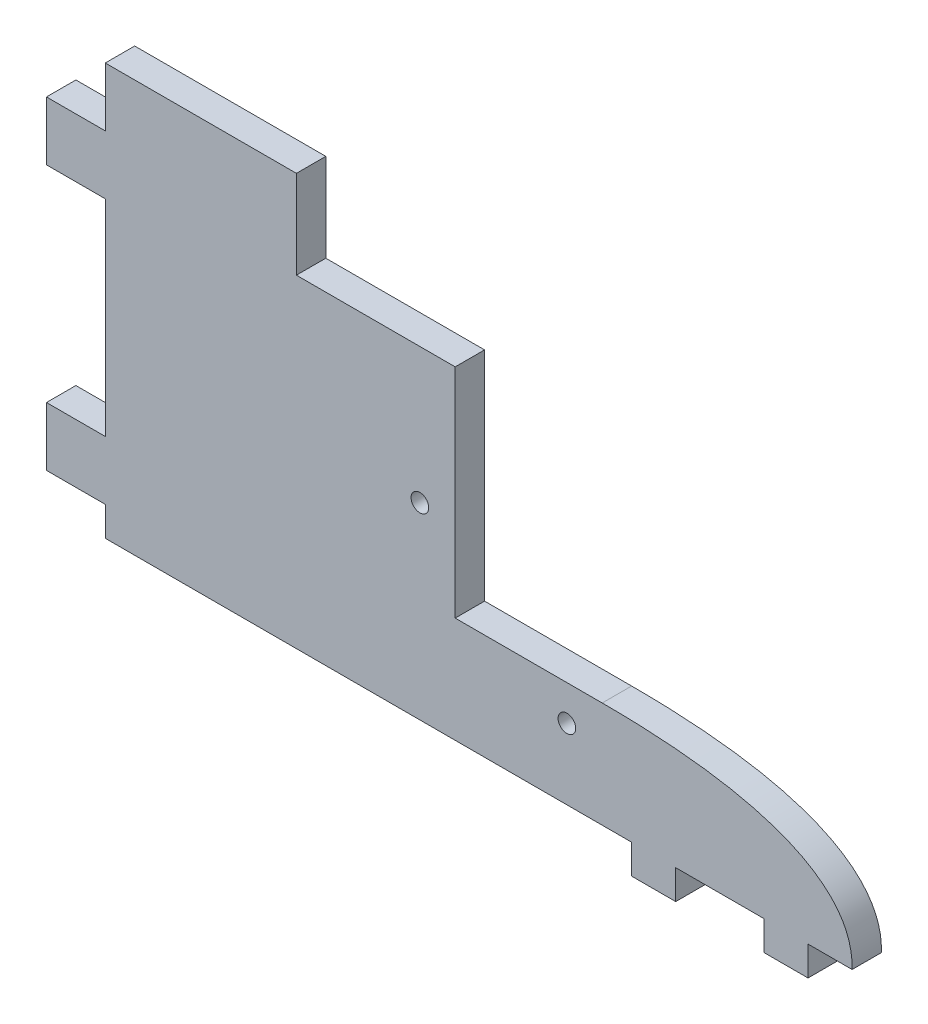
from build123d import *

# Parameters (mm, degrees)
ESQUISSE1_R        = 1.5
BOSS_EXTRU_1_DEPTH = 5
BOSS_EXTRU_2_DEPTH = 5


with BuildPart() as part:
    # Esquisse1 → Boss.-Extru.1 (new body)
    with BuildSketch(Plane.XY):
        Polygon((0, 0), (37, 0), (37, 18), (12, 18), (12, 55), (0, 55), align=None)
        with Locations((6, 32)):
            Circle(ESQUISSE1_R, mode=Mode.SUBTRACT)
        with Locations((31, 12)):
            Circle(ESQUISSE1_R, mode=Mode.SUBTRACT)
    extrude(amount=BOSS_EXTRU_1_DEPTH)

    # Esquisse2 → Boss.-Extru.2 (add)
    with BuildSketch(Plane.XY.offset(5)):
        with BuildLine():
            Line((37, 0), (42, 0))
            Line((42, 0), (42, -5))
            Line((42, -5), (49.5, -5))
            Line((49.5, -5), (49.5, 0))
            Line((49.5, 0), (64.5, 0))
            Line((64.5, 0), (64.5, -5))
            Line((64.5, -5), (72, -5))
            Line((72, -5), (72, 0))
            Line((72, 0), (79.5, 0))
            add(Edge.make_bspline(
                [(37, 18), (79.239532327, 18), (79.5, 3.874285435), (79.5, 0)],
                knots=[0, 0, 0, 0, 1, 1, 1, 1], degree=3))
            Line((37, 18), (37, 0))
        make_face()
        Polygon((0, 0), (-47.5, 0), (-47.5, 5), (-57.5, 5), (-57.5, 15), (-47.5, 15), (-47.5, 50), (-57.5, 50), (-57.5, 60), (-47.5, 60), (-47.5, 70), (-15, 70), (-15, 55), (0, 55), align=None)
    extrude(amount=-BOSS_EXTRU_2_DEPTH)


solid = part.part
